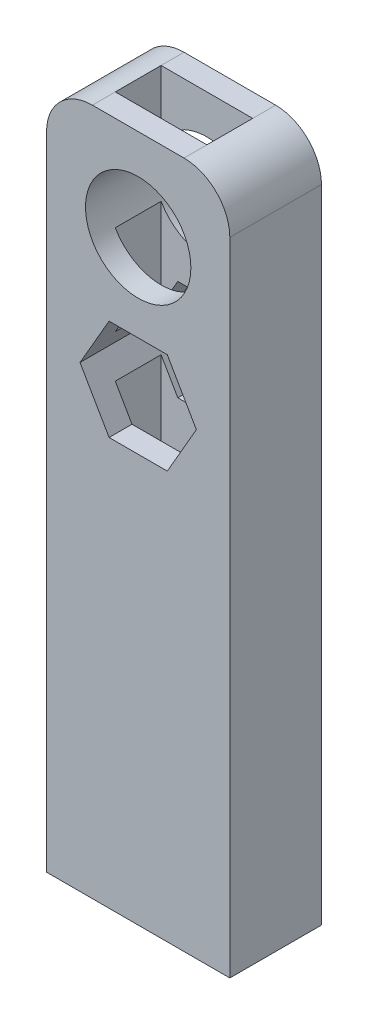
from build123d import *

# Parameters (mm, degrees)
ESQUISSE1_W                  = 40
ESQUISSE1_H                  = 20
BOSS_EXTRU_2_DEPTH           = 150
ESQUISSE2_R                  = 11.5
ENL_V_MAT_EXTRU_1_DEPTH      = 157.524758425
ENL_V_MAT_EXTRU_2_DEPTH      = 157.524758425
ENL_V_MAT_EXTRU_3_DEPTH      = 157.524758425
ENL_V_MAT_EXTRU_3_DEPTH_BACK = 157.524758425
ESQUISSE4_W                  = 20
ESQUISSE4_H                  = 10
CONG_2_R                     = 10
CONG_5_R                     = 10


with BuildPart() as part:
    # Esquisse1 → Boss.-Extru.2 (new body)
    with BuildSketch(Plane(origin=(0, 0, 0), x_dir=(1, 0, 0), z_dir=(0, 1, 0))):
        with Locations((-20, 10)):
            Rectangle(ESQUISSE1_W, ESQUISSE1_H)
    extrude(amount=BOSS_EXTRU_2_DEPTH)

    # Esquisse2 → Enlèv. mat.-Extru.1 (cut, through all)
    with BuildSketch(Plane.XY):
        with Locations((-20, 130)):
            Circle(ESQUISSE2_R)
    extrude(amount=-ENL_V_MAT_EXTRU_1_DEPTH, mode=Mode.SUBTRACT)

    # Esquisse3 → Enlèv. mat.-Extru.2 (cut, through all)
    with BuildSketch(Plane.XY):
        Polygon((-26.350852961, 111), (-32.701705922, 100), (-26.350852961, 89), (-13.649147039, 89), (-7.298294078, 100), (-13.649147039, 111), align=None)
    extrude(amount=-ENL_V_MAT_EXTRU_2_DEPTH, mode=Mode.SUBTRACT)

    # Esquisse4 → Enlèv. mat.-Extru.3 (cut, two sides: drawn at the far end of the back side and taken through both)
    with BuildSketch(Plane(origin=(0, 150, 0), x_dir=(1, 0, 0), z_dir=(0, 1, 0)).offset(-ENL_V_MAT_EXTRU_3_DEPTH_BACK)):
        with Locations((-20, 10)):
            Rectangle(ESQUISSE4_W, ESQUISSE4_H)
    extrude(amount=ENL_V_MAT_EXTRU_3_DEPTH + ENL_V_MAT_EXTRU_3_DEPTH_BACK, mode=Mode.SUBTRACT)

    # Congé2
    cong_2_edges = [part.edges().sort_by_distance(p)[0] for p in [
        (0, 150, -10),
    ]]
    fillet(cong_2_edges, radius=CONG_2_R - 0.0001)  # a hair under: the kernel refuses the full size

    # Congé5
    cong_5_edges = [part.edges().sort_by_distance(p)[0] for p in [
        (-40, 150, -10),
    ]]
    fillet(cong_5_edges, radius=CONG_5_R - 0.0001)  # a hair under: the kernel refuses the full size


solid = part.part
